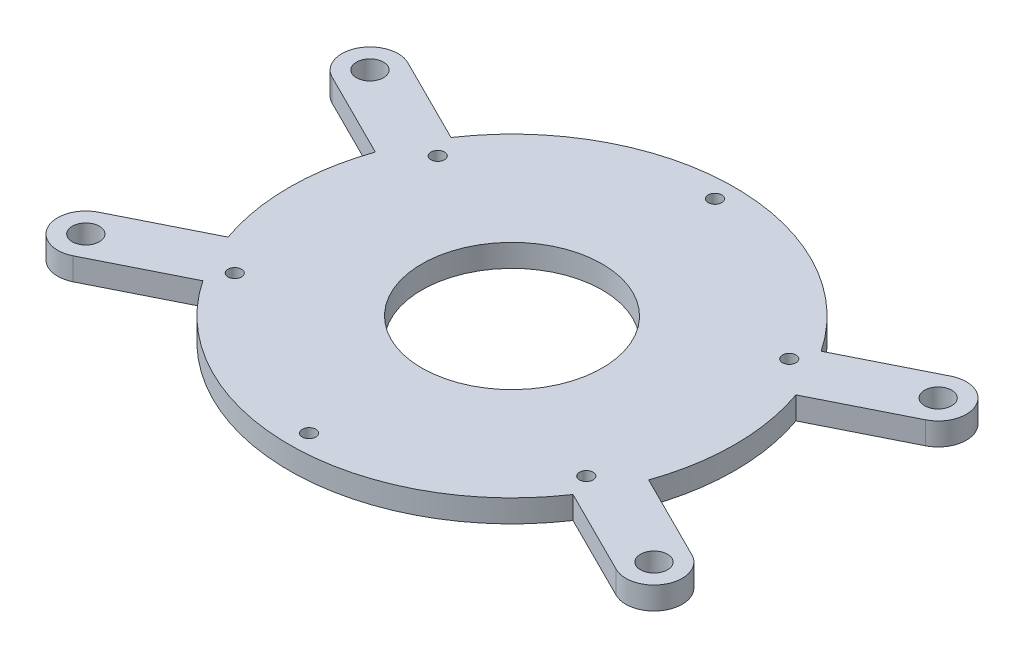
from build123d import *

# Parameters (mm, degrees)
SKETCH_1_R               = 20
EXTRUDE_1_DEPTH          = 5
CUT_EXTRUDE_1_REACH      = 87.2
SKETCH_2_R               = 3
MIRROR_2_COPY_1_REACH    = 87.2
MIRROR_2_COPY_1_SKETCH_R = 3
MIRROR_2_COPY_2_REACH    = 87.2
MIRROR_2_COPY_2_SKETCH_R = 3
SKETCH_3_R               = 1.5
CUT_EXTRUDE_2_DEPTH      = 86.199993462
PATTERN_CIRCULAR_1_COUNT = 6


with BuildPart() as part:
    # 草图1 → 凸台-拉伸1 (new body)
    with BuildSketch(Plane(origin=(0, 0, 0), x_dir=(1, 0, 0), z_dir=(0, 1, 0))):
        with BuildLine():
            Line((46.623322285, 16.328680875), (65.781966365, 25.910071498))
            ThreePointArc((65.781966365, 25.910071498), (68.576327064, 34.295567803), (60.190830759, 37.089928502))
            Line((60.190830759, 37.089928502), (41.03218668, 27.50853788))
            ThreePointArc((41.03218668, 27.50853788), (0, 49.4), (-41.03218668, 27.50853788))
            Line((-41.03218668, 27.50853788), (-60.190830759, 37.089928502))
            ThreePointArc((-60.190830759, 37.089928502), (-68.576327064, 34.295567803), (-65.781966365, 25.910071498))
            Line((-65.781966365, 25.910071498), (-46.623322285, 16.328680875))
            ThreePointArc((-46.623322285, 16.328680875), (-49.4, 0), (-46.623322285, -16.328680875))
            Line((-46.623322285, -16.328680875), (-65.781966365, -25.910071498))
            ThreePointArc((-65.781966365, -25.910071498), (-68.576327064, -34.295567803), (-60.190830759, -37.089928502))
            Line((-60.190830759, -37.089928502), (-41.03218668, -27.50853788))
            ThreePointArc((-41.03218668, -27.50853788), (0, -49.4), (41.03218668, -27.50853788))
            Line((41.03218668, -27.50853788), (60.190830759, -37.089928502))
            ThreePointArc((60.190830759, -37.089928502), (68.576327064, -34.295567803), (65.781966365, -25.910071498))
            Line((65.781966365, -25.910071498), (46.623322285, -16.328680875))
            ThreePointArc((46.623322285, -16.328680875), (49.4, 0), (46.623322285, 16.328680875))
        make_face()
        Circle(SKETCH_1_R, mode=Mode.SUBTRACT)
    extrude(amount=EXTRUDE_1_DEPTH)

    # 草图2 → 切除-拉伸1 (cut, up to next)
    with BuildSketch(Plane(origin=(0, 5, 0), x_dir=(1, 0, 0), z_dir=(0, 1, 0)), mode=Mode.PRIVATE) as cut_extrude_1_sk1:
        with Locations((-62.986398562, 31.5)):
            Circle(SKETCH_2_R)
    cut_extrude_1_tool1 = extrude(cut_extrude_1_sk1.sketch, amount=-CUT_EXTRUDE_1_REACH, mode=Mode.PRIVATE) & part.part
    cut_extrude_1 = cut_extrude_1_tool1.solids().sort_by_distance((-62.986399, 5, -31.5))[0]
    add(cut_extrude_1, mode=Mode.SUBTRACT)

    # 镜向1: 切除-拉伸1 across plane
    add(cut_extrude_1.mirror(Plane.XY), mode=Mode.SUBTRACT)

    # 镜向2 copy 1 sketch → 镜向2 copy 1 (cut, up to next)
    with BuildSketch(Plane(origin=(0, 5, 0), x_dir=(-1, 0, 0), z_dir=(0, 1, 0)), mode=Mode.PRIVATE) as mirror_2_copy_1_sk1:
        with Locations((-62.986398562, 31.5)):
            Circle(MIRROR_2_COPY_1_SKETCH_R)
    mirror_2_copy_1_tool1 = extrude(mirror_2_copy_1_sk1.sketch, amount=-MIRROR_2_COPY_1_REACH, mode=Mode.PRIVATE) & part.part
    add(mirror_2_copy_1_tool1.solids().sort_by_distance((62.986399, 5, 31.5))[0], mode=Mode.SUBTRACT)

    # 镜向2 copy 2 sketch → 镜向2 copy 2 (cut, up to next)
    with BuildSketch(Plane(origin=(0, 5, 0), x_dir=(-1, 0, 0), z_dir=(0, 1, 0)), mode=Mode.PRIVATE) as mirror_2_copy_2_sk1:
        with Locations((-62.986398562, -31.5)):
            Circle(MIRROR_2_COPY_2_SKETCH_R)
    mirror_2_copy_2_tool1 = extrude(mirror_2_copy_2_sk1.sketch, amount=-MIRROR_2_COPY_2_REACH, mode=Mode.PRIVATE) & part.part
    add(mirror_2_copy_2_tool1.solids().sort_by_distance((62.986399, 5, -31.5))[0], mode=Mode.SUBTRACT)

    # 草图3 → 切除-拉伸2 (cut, through all)
    with BuildSketch(Plane.XZ):
        with Locations((0, 45)):
            Circle(SKETCH_3_R)
    cut_extrude_2 = extrude(amount=-CUT_EXTRUDE_2_DEPTH, mode=Mode.SUBTRACT)

    # 阵列(圆周)1: 切除-拉伸2 ×6 about axis
    pattern_circular_1_axis = Axis((0, 0, 0), (0, 1, 0))
    for i in range(1, PATTERN_CIRCULAR_1_COUNT):
        add(cut_extrude_2.rotate(pattern_circular_1_axis, i * 360 / PATTERN_CIRCULAR_1_COUNT), mode=Mode.SUBTRACT)


solid = part.part
